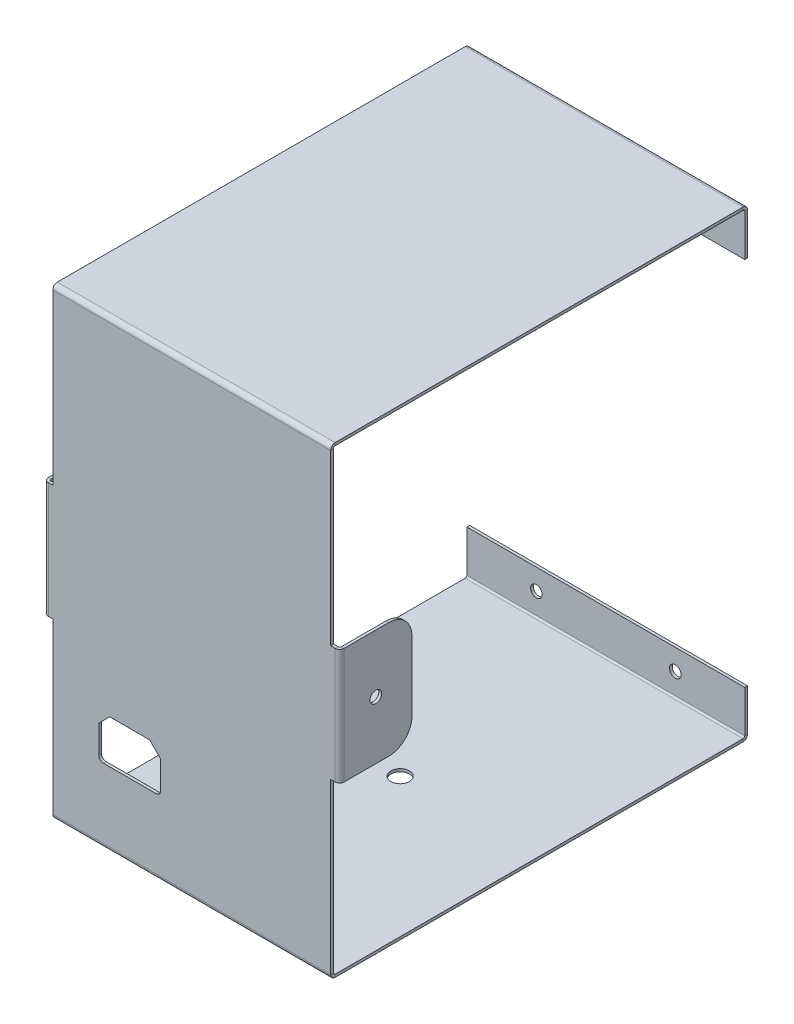
from build123d import *

# Parameters (mm, degrees)
SKETCH1_W                      = 120
SKETCH1_H                      = 200
BASE_FLANGE1_DEPTH             = 1.2
EDGE_FLANGE1_STRIP_W           = 6.2732
EDGE_FLANGE1_STRIP_H           = 1.2
EDGE_FLANGE1_STRIP_CUT_DEPTH   = 120
EDGE_FLANGE1_STRIP_2_W         = 6.2732
EDGE_FLANGE1_STRIP_2_H         = 1.2
EDGE_FLANGE1_STRIP_CUT_2_DEPTH = 120
EDGE_FLANGE1_DEPTH             = 120
EDGE_FLANGE1_BEND_DEPTH        = 120
EDGE_FLANGE3_START             = -121.9366
EDGE_FLANGE3_OUTLINE_W         = 50
EDGE_FLANGE3_OUTLINE_H         = 1.2
EDGE_FLANGE3_DEPTH             = 123.8732
EDGE_FLANGE3_START_2           = -25
EDGE_FLANGE3_2_DEPTH           = 50
EDGE_FLANGE3_START_3           = -65
EDGE_FLANGE3_3_DEPTH           = 130
EDGE_FLANGE4_STRIP_W           = 6.2732
EDGE_FLANGE4_STRIP_H           = 1.2
EDGE_FLANGE4_STRIP_CUT_DEPTH   = 120
EDGE_FLANGE4_STRIP_2_W         = 6.2732
EDGE_FLANGE4_STRIP_2_H         = 1.2
EDGE_FLANGE4_STRIP_CUT_2_DEPTH = 120
EDGE_FLANGE4_DEPTH             = 120
EDGE_FLANGE4_BEND_DEPTH        = 120
SKETCH34_R                     = 4
CUT_EXTRUDE1_DEPTH             = 10
CUT_EXTRUDE2_DEPTH             = 10
SKETCH36_R                     = 2.5
CUT_EXTRUDE3_DEPTH             = 243.320330787
SKETCH37_R                     = 2.5
CUT_EXTRUDE4_DEPTH             = 10


with BuildPart() as part:
    # Base-Flange1: sheet metal written as solids
    # Sketch1 → Base-Flange1 (new body)
    with BuildSketch(Plane.XY):
        Rectangle(SKETCH1_W, SKETCH1_H)
    extrude(amount=-BASE_FLANGE1_DEPTH)

    # Edge-Flange1: sheet metal written as solids
    # Edge-Flange1 strip (on a plane across the edge) → Edge-Flange1 strip cut (cut)
    with BuildSketch(Plane(origin=(-60, 100, -1.2), x_dir=(0, -1, 0), z_dir=(1, 0, 0))):
        with Locations((-1.2, -0.6)):
            Rectangle(EDGE_FLANGE1_STRIP_W, EDGE_FLANGE1_STRIP_H)
    extrude(amount=EDGE_FLANGE1_STRIP_CUT_DEPTH, mode=Mode.SUBTRACT)

    # Edge-Flange1 strip 2 (on a plane across the edge) → Edge-Flange1 strip cut 2 (cut)
    with BuildSketch(Plane(origin=(60, -100, -1.2), x_dir=(0, 1, 0), z_dir=(-1, 0, 0))):
        with Locations((-1.2, -0.6)):
            Rectangle(EDGE_FLANGE1_STRIP_2_W, EDGE_FLANGE1_STRIP_2_H)
    extrude(amount=EDGE_FLANGE1_STRIP_CUT_2_DEPTH, mode=Mode.SUBTRACT)

    # Edge-Flange1 section (on a plane across the edge) → Edge-Flange1 (add)
    with BuildSketch(Plane(origin=(-60, 100, -1.2), x_dir=(0, -1, 0), z_dir=(1, 0, 0))):
        with BuildLine():
            Line((0, 0.7366), (0, 178.8))
            Line((0, 178.8), (1.2, 178.8))
            Line((1.2, 178.8), (1.2, 0.7366))
            ThreePointArc((1.2, 0.7366), (1.415745145, 0.215745145), (1.9366, 0))
            Line((1.9366, 0), (1.9366, -1.2))
            ThreePointArc((1.9366, -1.2), (0.567217008, -0.632782992), (0, 0.7366))
        make_face()
    extrude(amount=EDGE_FLANGE1_DEPTH)

    # Edge-Flange1 section 2 (on a plane across the edge) → Edge-Flange1 bend (add)
    with BuildSketch(Plane(origin=(60, -100, -1.2), x_dir=(0, 1, 0), z_dir=(-1, 0, 0))):
        with BuildLine():
            Line((0, 0.7366), (0, 178.8))
            Line((0, 178.8), (1.2, 178.8))
            Line((1.2, 178.8), (1.2, 0.7366))
            ThreePointArc((1.2, 0.7366), (1.415745145, 0.215745145), (1.9366, 0))
            Line((1.9366, 0), (1.9366, -1.2))
            ThreePointArc((1.9366, -1.2), (0.567217008, -0.632782992), (0, 0.7366))
        make_face()
    extrude(amount=EDGE_FLANGE1_BEND_DEPTH)

    # Edge-Flange3: read off the stored shape, not the designer's step
    # Edge-Flange3 outline → Edge-Flange3 (add)
    with BuildSketch(Plane(origin=(60, 0, -1.2), x_dir=(0, -1, 0), z_dir=(1, 0, 0)).offset(EDGE_FLANGE3_START)):
        with Locations((0, -0.6)):
            Rectangle(EDGE_FLANGE3_OUTLINE_W, EDGE_FLANGE3_OUTLINE_H)
    extrude(amount=EDGE_FLANGE3_DEPTH)

    # Edge-Flange3 2 outline → Edge-Flange3 2 (add)
    with BuildSketch(Plane(origin=(0, 0, 0), x_dir=(1, 0, 0), z_dir=(0, 1, 0)).offset(EDGE_FLANGE3_START_2)):
        with BuildLine():
            ThreePointArc((61.9366, 0), (63.305982992, 0.567217008), (63.8732, 1.9366))
            Line((63.8732, 1.9366), (63.8732, 31.2))
            Line((63.8732, 31.2), (62.6732, 31.2))
            Line((62.6732, 31.2), (62.6732, 1.9366))
            ThreePointArc((62.6732, 1.9366), (62.457454855, 1.415745145), (61.9366, 1.2))
            Line((61.9366, 1.2), (61.9366, 0))
        make_face()
        with BuildLine():
            Line((-62.6732, 31.2), (-63.8732, 31.2))
            Line((-63.8732, 31.2), (-63.8732, 1.9366))
            ThreePointArc((-63.8732, 1.9366), (-63.305982992, 0.567217008), (-61.9366, 0))
            Line((-61.9366, 0), (-61.9366, 1.2))
            ThreePointArc((-61.9366, 1.2), (-62.457454855, 1.415745145), (-62.6732, 1.9366))
            Line((-62.6732, 1.9366), (-62.6732, 31.2))
        make_face()
    extrude(amount=EDGE_FLANGE3_2_DEPTH)

    # Edge-Flange3 3 outline → Edge-Flange3 3 (cut)
    with BuildSketch(Plane.YZ.offset(EDGE_FLANGE3_START_3)):
        with BuildLine():
            Line((-25, -31.2), (-15, -31.2))
            ThreePointArc((-15, -31.2), (-22.071067812, -28.271067812), (-25, -21.2))
            Line((-25, -21.2), (-25, -31.2))
        make_face()
        with BuildLine():
            ThreePointArc((25, -21.2), (22.071067812, -28.271067812), (15, -31.2))
            Line((15, -31.2), (25, -31.2))
            Line((25, -31.2), (25, -21.2))
        make_face()
    extrude(amount=EDGE_FLANGE3_3_DEPTH, mode=Mode.SUBTRACT)

    # Edge-Flange4: sheet metal written as solids
    # Edge-Flange4 strip (on a plane across the edge) → Edge-Flange4 strip cut (cut)
    with BuildSketch(Plane(origin=(-60, 98.8, -180), x_dir=(0, 0, 1), z_dir=(1, 0, 0))):
        with Locations((-1.2, -0.6)):
            Rectangle(EDGE_FLANGE4_STRIP_W, EDGE_FLANGE4_STRIP_H)
    extrude(amount=EDGE_FLANGE4_STRIP_CUT_DEPTH, mode=Mode.SUBTRACT)

    # Edge-Flange4 strip 2 (on a plane across the edge) → Edge-Flange4 strip cut 2 (cut)
    with BuildSketch(Plane(origin=(60, -98.8, -180), x_dir=(0, 0, 1), z_dir=(-1, 0, 0))):
        with Locations((-1.2, -0.6)):
            Rectangle(EDGE_FLANGE4_STRIP_2_W, EDGE_FLANGE4_STRIP_2_H)
    extrude(amount=EDGE_FLANGE4_STRIP_CUT_2_DEPTH, mode=Mode.SUBTRACT)

    # Edge-Flange4 section (on a plane across the edge) → Edge-Flange4 (add)
    with BuildSketch(Plane(origin=(-60, 98.8, -180), x_dir=(0, 0, 1), z_dir=(1, 0, 0))):
        with BuildLine():
            Line((0, 0.7366), (0, 18.8))
            Line((0, 18.8), (1.2, 18.8))
            Line((1.2, 18.8), (1.2, 0.7366))
            ThreePointArc((1.2, 0.7366), (1.415745145, 0.215745145), (1.9366, 0))
            Line((1.9366, 0), (1.9366, -1.2))
            ThreePointArc((1.9366, -1.2), (0.567217008, -0.632782992), (0, 0.7366))
        make_face()
    extrude(amount=EDGE_FLANGE4_DEPTH)

    # Edge-Flange4 section 2 (on a plane across the edge) → Edge-Flange4 bend (add)
    with BuildSketch(Plane(origin=(60, -98.8, -180), x_dir=(0, 0, 1), z_dir=(-1, 0, 0))):
        with BuildLine():
            Line((0, 0.7366), (0, 18.8))
            Line((0, 18.8), (1.2, 18.8))
            Line((1.2, 18.8), (1.2, 0.7366))
            ThreePointArc((1.2, 0.7366), (1.415745145, 0.215745145), (1.9366, 0))
            Line((1.9366, 0), (1.9366, -1.2))
            ThreePointArc((1.9366, -1.2), (0.567217008, -0.632782992), (0, 0.7366))
        make_face()
    extrude(amount=EDGE_FLANGE4_BEND_DEPTH)

    # Sketch34 → Cut-Extrude1 (cut)
    with BuildSketch(Plane.XZ.offset(100)):
        with Locations(Location((0, -90, 0), (0, 0, 270))):
            Circle(SKETCH34_R)
    extrude(amount=-CUT_EXTRUDE1_DEPTH, mode=Mode.SUBTRACT)

    # Sketch35 → Cut-Extrude2 (cut)
    with BuildSketch(Plane.XY):
        with BuildLine():
            Line((-31.3, -68), (-38.15, -68))
            ThreePointArc((-38.15, -68), (-39.564213562, -67.414213562), (-40.15, -66))
            Line((-40.15, -66), (-40.15, -54.035786438))
            Line((-40.15, -54.035786438), (-35.414213562, -49.3))
            Line((-35.414213562, -49.3), (-18.185786438, -49.3))
            Line((-18.185786438, -49.3), (-13.45, -54.035786438))
            Line((-13.45, -54.035786438), (-13.45, -66))
            ThreePointArc((-13.45, -66), (-14.035786438, -67.414213562), (-15.45, -68))
            Line((-15.45, -68), (-22.3, -68))
            Line((-22.3, -68), (-22.55, -68))
            Line((-22.55, -68), (-31.05, -68))
            Line((-31.05, -68), (-31.3, -68))
        make_face()
    extrude(amount=-CUT_EXTRUDE2_DEPTH, mode=Mode.SUBTRACT)

    # Sketch36 → Cut-Extrude3 (cut, through all)
    with BuildSketch(Plane.ZY.offset(63.8732)):
        with Locations((-15.6, 0)):
            Circle(SKETCH36_R)
    extrude(amount=-CUT_EXTRUDE3_DEPTH, mode=Mode.SUBTRACT)

    # Sketch37 → Cut-Extrude4 (cut)
    with BuildSketch(Plane(origin=(0, 0, -180), x_dir=(-1, 0, 0), z_dir=(0, 0, -1))):
        with Locations(Location((-30, 89.0317, 0), (0, 0, 90))):
            Circle(SKETCH37_R)
        with Locations(Location((30, 89.0317, 0), (0, 0, 90))):
            Circle(SKETCH37_R)
        with Locations(Location((30, -89.0317, 0), (0, 0, 90))):
            Circle(SKETCH37_R)
        with Locations(Location((-30, -89.0317, 0), (0, 0, 180))):
            Circle(SKETCH37_R)
    extrude(amount=-CUT_EXTRUDE4_DEPTH, mode=Mode.SUBTRACT)


solid = part.part
